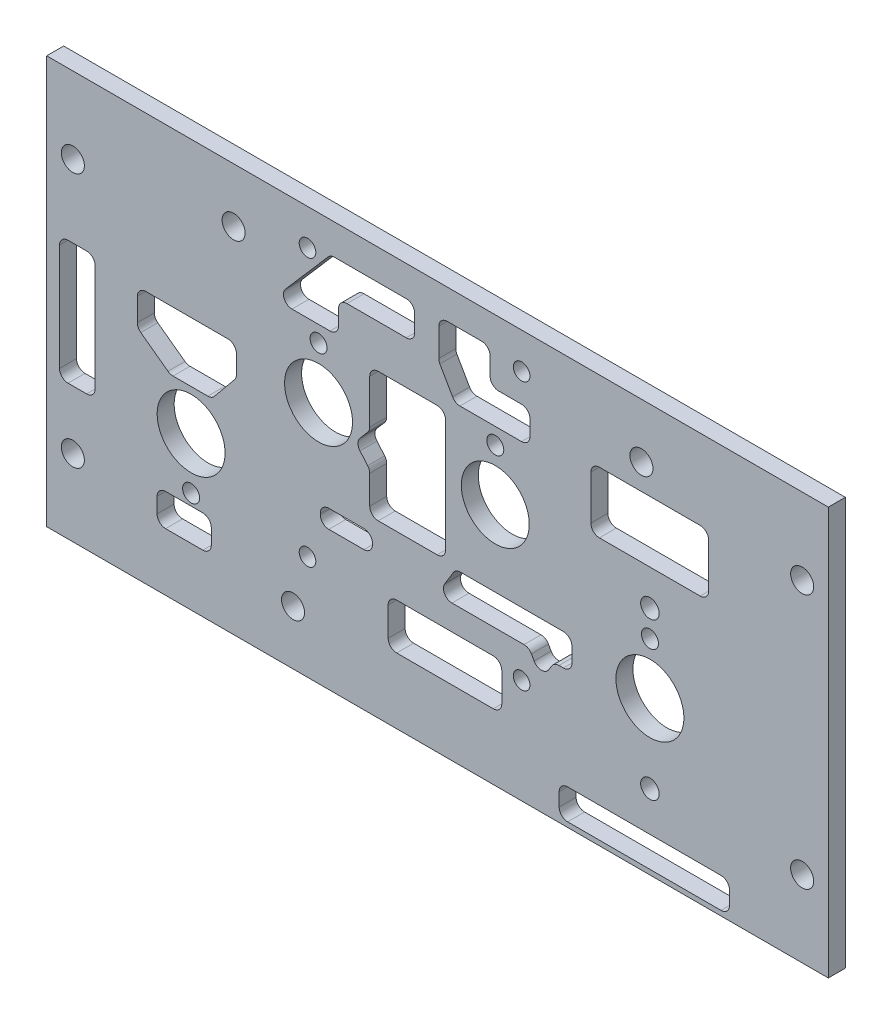
from build123d import *

# Parameters (mm, degrees)
SKETCH1_W                    = 146.05
SKETCH1_H                    = 76.2
BOSS_EXTRUDE1_DEPTH          = 3.175
F_1_8_0_125_DIAMETER_HOLE1_D = 3.175
F_1_2_0_5_DIAMETER_HOLE1_D   = 12.7
F_6_CLEARANCE_HOLE1_D        = 4.3053
F_4_CLEARANCE_HOLE1_D        = 3.4544
SKETCH11_R                   = 1.55
BACKLIGHTING_LED_HOLES_DEPTH = 165.763840466


with BuildPart() as part:
    # Sketch1 → Boss-Extrude1 (new body)
    with BuildSketch(Plane.XY):
        with Locations((-73.025, 38.1)):
            Rectangle(SKETCH1_W, SKETCH1_H)
    extrude(amount=-BOSS_EXTRUDE1_DEPTH)

    # 1/8 (0.125) Diameter Hole1 (through all)
    with Locations(Plane(origin=(0, 0, -3.175), x_dir=(-1, 0, 0), z_dir=(0, 0, -1))):
        with Locations((95.25, 55.118), (119.0625, 18.923), (62.23, 55.118), (33.3375, 38.227)):
            Hole(F_1_8_0_125_DIAMETER_HOLE1_D / 2)

    # 1/2 (0.5) Diameter Hole1 (through all)
    with Locations(Plane(origin=(0, 0, -3.175), x_dir=(-1, 0, 0), z_dir=(0, 0, -1))):
        with Locations((95.25, 45.466), (119.0625, 28.575), (62.23, 45.466), (33.3375, 28.575)):
            Hole(F_1_2_0_5_DIAMETER_HOLE1_D / 2)

    # #6 Clearance Hole1 (through all)
    with Locations(Plane(origin=(0, 0, -3.175), x_dir=(-1, 0, 0), z_dir=(0, 0, -1))):
        with Locations((141.1605, 61.9125), (141.1605, 14.2875), (4.8895, 61.9125), (4.8895, 14.2875), (111.125, 66.04), (100.01504, 10.16), (34.925, 66.04)):
            Hole(F_6_CLEARANCE_HOLE1_D / 2)

    # #4 Clearance Hole1 (through all)
    with Locations(Plane(origin=(0, 0, -3.175), x_dir=(-1, 0, 0), z_dir=(0, 0, -1))):
        with Locations((33.3375, 43.18), (33.3375, 13.97)):
            Hole(F_4_CLEARANCE_HOLE1_D / 2)

    # Sketch11 → Backlighting LED Holes (cut, through all)
    with BuildSketch(Plane(origin=(0, 0, -3.175), x_dir=(-1, 0, 0), z_dir=(0, 0, -1))):
        with Locations((57.308481915, 69.502362759)):
            Circle(SKETCH11_R)
        with Locations((97.316390057, 69.502362759)):
            Circle(SKETCH11_R)
        with Locations((57.308481915, 19.508183769)):
            Circle(SKETCH11_R)
        with Locations((97.316390057, 19.508183769)):
            Circle(SKETCH11_R)
        with BuildLine():
            Line((23.948701738, 61.259955387), (42.783329433, 61.259955387))
            ThreePointArc((42.783329433, 61.259955387), (43.905861448, 60.794987403), (44.370829433, 59.672455387))
            Line((44.370829433, 59.672455387), (44.370829433, 51.419528758))
            ThreePointArc((44.370829433, 51.419528758), (43.905861448, 50.296996743), (42.783329433, 49.832028758))
            Line((42.783329433, 49.832028758), (23.948701738, 49.832028758))
            ThreePointArc((23.948701738, 49.832028758), (22.826169723, 50.296996743), (22.361201738, 51.419528758))
            Line((22.361201738, 51.419528758), (22.361201738, 59.672455387))
            ThreePointArc((22.361201738, 59.672455387), (22.826169723, 60.794987403), (23.948701738, 61.259955387))
        make_face()
        with BuildLine():
            Line((64.780071341, 70.654448124), (71.201339032, 70.654448124))
            ThreePointArc((71.201339032, 70.654448124), (72.323871047, 70.189480139), (72.788839032, 69.066948124))
            Line((72.788839032, 69.066948124), (72.788839032, 63.862845981))
            ThreePointArc((72.788839032, 63.862845981), (72.735316858, 63.454106112), (72.578359309, 63.072927373))
            Line((72.578359309, 63.072927373), (70.206670251, 58.938496447))
            ThreePointArc((70.206670251, 58.938496447), (69.625313364, 58.354706199), (68.829649974, 58.140915055))
            Line((68.829649974, 58.140915055), (57.333367613, 58.140915055))
            ThreePointArc((57.333367613, 58.140915055), (56.210835598, 58.60588304), (55.745867613, 59.728415055))
            Line((55.745867613, 59.728415055), (55.745867613, 62.595888343))
            ThreePointArc((55.745867613, 62.595888343), (56.210835598, 63.718420358), (57.333367613, 64.183388343))
            Line((57.333367613, 64.183388343), (61.605071341, 64.183388343))
            ThreePointArc((61.605071341, 64.183388343), (62.727603357, 64.648356328), (63.192571341, 65.770888343))
            Line((63.192571341, 65.770888343), (63.192571341, 69.066948124))
            ThreePointArc((63.192571341, 69.066948124), (63.657539326, 70.189480139), (64.780071341, 70.654448124))
        make_face()
        with BuildLine():
            Line((78.87082721, 70.489430061), (92.270025031, 70.489430061))
            ThreePointArc((92.270025031, 70.489430061), (92.929418885, 70.346006234), (93.469665918, 69.941650211))
            Line((93.469665918, 69.941650211), (101.420285558, 60.768135206))
            ThreePointArc((101.420285558, 60.768135206), (101.664720844, 59.0690212), (100.22064467, 58.140915055))
            Line((100.22064467, 58.140915055), (93.109864956, 58.140915055))
            ThreePointArc((93.109864956, 58.140915055), (91.987332941, 58.60588304), (91.522364956, 59.728415055))
            Line((91.522364956, 59.728415055), (91.522364956, 62.57909604))
            ThreePointArc((91.522364956, 62.57909604), (91.057396971, 63.701628055), (89.934864956, 64.16659604))
            Line((89.934864956, 64.16659604), (78.87082721, 64.16659604))
            ThreePointArc((78.87082721, 64.16659604), (77.748295195, 64.631564024), (77.28332721, 65.75409604))
            Line((77.28332721, 65.75409604), (77.28332721, 68.901930061))
            ThreePointArc((77.28332721, 68.901930061), (77.748295195, 70.024462076), (78.87082721, 70.489430061))
        make_face()
        with BuildLine():
            Line((73.096623307, 56.116253723), (84.101981767, 56.116253723))
            ThreePointArc((84.101981767, 56.116253723), (85.224513783, 55.651285738), (85.689481767, 54.528753723))
            Line((85.689481767, 54.528753723), (85.689481767, 46.305527038))
            ThreePointArc((85.689481767, 46.305527038), (85.788811506, 45.752801497), (86.074370615, 45.269243936))
            Line((86.074370615, 45.269243936), (87.505032443, 43.608954517))
            ThreePointArc((87.505032443, 43.608954517), (87.889920523, 42.574233054), (87.507068918, 41.538756358))
            Line((87.507068918, 41.538756358), (86.072334141, 39.867100807))
            ThreePointArc((86.072334141, 39.867100807), (85.788268505, 39.384447096), (85.689481767, 38.83318575))
            Line((85.689481767, 38.83318575), (85.689481767, 33.514880522))
            ThreePointArc((85.689481767, 33.514880522), (85.224513783, 32.392348507), (84.101981767, 31.927380522))
            Line((84.101981767, 31.927380522), (73.096623307, 31.927380522))
            ThreePointArc((73.096623307, 31.927380522), (71.974091291, 32.392348507), (71.509123307, 33.514880522))
            Line((71.509123307, 33.514880522), (71.509123307, 54.528753723))
            ThreePointArc((71.509123307, 54.528753723), (71.974091291, 55.651285738), (73.096623307, 56.116253723))
        make_face()
        with BuildLine():
            Line((49.495086903, 31.307548148), (68.728160767, 31.307548148))
            ThreePointArc((68.728160767, 31.307548148), (69.504729221, 31.104641116), (70.082782777, 30.547789326))
            Line((70.082782777, 30.547789326), (71.680994153, 27.932270896))
            ThreePointArc((71.680994153, 27.932270896), (71.71096511, 26.327961263), (70.326372142, 25.517029718))
            Line((70.326372142, 25.517029718), (56.856618733, 25.517029718))
            ThreePointArc((56.856618733, 25.517029718), (56.054963226, 25.299750393), (55.47275108, 24.707389967))
            Line((55.47275108, 24.707389967), (54.96899506, 23.811172863))
            ThreePointArc((54.96899506, 23.811172863), (53.614038541, 23.001796395), (52.230505396, 23.761291934))
            Line((52.230505396, 23.761291934), (51.684339715, 24.655107626))
            ThreePointArc((51.684339715, 24.655107626), (51.106286159, 25.211959415), (50.329717704, 25.414866448))
            Line((50.329717704, 25.414866448), (49.495086903, 25.414866448))
            ThreePointArc((49.495086903, 25.414866448), (48.372554888, 25.879834433), (47.907586903, 27.002366448))
            Line((47.907586903, 27.002366448), (47.907586903, 29.720048148))
            ThreePointArc((47.907586903, 29.720048148), (48.372554888, 30.842580163), (49.495086903, 31.307548148))
        make_face()
        with BuildLine():
            Line((138.589154923, 48.348748794), (142.062048865, 48.348748794))
            ThreePointArc((142.062048865, 48.348748794), (143.18458088, 47.883780809), (143.649548865, 46.761248794))
            Line((143.649548865, 46.761248794), (143.649548865, 26.810643633))
            ThreePointArc((143.649548865, 26.810643633), (143.18458088, 25.688111618), (142.062048865, 25.223143633))
            Line((142.062048865, 25.223143633), (138.589154923, 25.223143633))
            ThreePointArc((138.589154923, 25.223143633), (137.466622908, 25.688111618), (137.001654923, 26.810643633))
            Line((137.001654923, 26.810643633), (137.001654923, 46.761248794))
            ThreePointArc((137.001654923, 46.761248794), (137.466622908, 47.883780809), (138.589154923, 48.348748794))
        make_face()
        with BuildLine():
            Line((112.187953155, 47.328686282), (127.528056033, 47.328686282))
            ThreePointArc((127.528056033, 47.328686282), (128.650588048, 46.863718297), (129.115556033, 45.741186282))
            Line((129.115556033, 45.741186282), (129.115556033, 41.488707605))
            ThreePointArc((129.115556033, 41.488707605), (128.943947253, 40.770788179), (128.466222738, 40.20808296))
            Line((128.466222738, 40.20808296), (123.390276389, 36.489519616))
            ThreePointArc((123.390276389, 36.489519616), (122.945650272, 36.261312284), (122.452109684, 36.182644262))
            Line((122.452109684, 36.182644262), (115.941089528, 36.182644262))
            ThreePointArc((115.941089528, 36.182644262), (115.262424348, 36.335024119), (114.71404566, 36.762910627))
            Line((114.71404566, 36.762910627), (110.960909287, 41.335100049))
            ThreePointArc((110.960909287, 41.335100049), (110.69328122, 41.807439251), (110.600453155, 42.342333684))
            Line((110.600453155, 42.342333684), (110.600453155, 45.741186282))
            ThreePointArc((110.600453155, 45.741186282), (111.06542114, 46.863718297), (112.187953155, 47.328686282))
        make_face()
        with BuildLine():
            Line((20.051024651, 6.571971652), (48.712319434, 6.571971652))
            ThreePointArc((48.712319434, 6.571971652), (49.834851449, 6.107003667), (50.299819434, 4.984471652))
            Line((50.299819434, 4.984471652), (50.299819434, 2.503851427))
            ThreePointArc((50.299819434, 2.503851427), (49.834851449, 1.381319412), (48.712319434, 0.916351427))
            Line((48.712319434, 0.916351427), (20.051024651, 0.916351427))
            ThreePointArc((20.051024651, 0.916351427), (18.928492635, 1.381319412), (18.463524651, 2.503851427))
            Line((18.463524651, 2.503851427), (18.463524651, 4.984471652))
            ThreePointArc((18.463524651, 4.984471652), (18.928492635, 6.107003667), (20.051024651, 6.571971652))
        make_face()
        with BuildLine():
            Line((116.881679104, 16.821615791), (123.831598801, 16.821615791))
            ThreePointArc((123.831598801, 16.821615791), (124.954130816, 16.356647806), (125.419098801, 15.234115791))
            Line((125.419098801, 15.234115791), (125.419098801, 12.383018457))
            ThreePointArc((125.419098801, 12.383018457), (124.954130816, 11.260486442), (123.831598801, 10.795518457))
            Line((123.831598801, 10.795518457), (116.881679104, 10.795518457))
            ThreePointArc((116.881679104, 10.795518457), (115.759147089, 11.260486442), (115.294179104, 12.383018457))
            Line((115.294179104, 12.383018457), (115.294179104, 15.234115791))
            ThreePointArc((115.294179104, 15.234115791), (115.759147089, 16.356647806), (116.881679104, 16.821615791))
        make_face()
        with BuildLine():
            Line((86.76531931, 29.342846343), (93.337345817, 29.342846343))
            ThreePointArc((93.337345817, 29.342846343), (94.459877833, 28.877878358), (94.924845817, 27.755346343))
            Line((94.924845817, 27.755346343), (94.924845817, 27.524144469))
            ThreePointArc((94.924845817, 27.524144469), (94.459877833, 26.401612454), (93.337345817, 25.936644469))
            Line((93.337345817, 25.936644469), (86.76531931, 25.936644469))
            ThreePointArc((86.76531931, 25.936644469), (85.642787295, 26.401612454), (85.17781931, 27.524144469))
            Line((85.17781931, 27.524144469), (85.17781931, 27.755346343))
            ThreePointArc((85.17781931, 27.755346343), (85.642787295, 28.877878358), (86.76531931, 29.342846343))
        make_face()
        with BuildLine():
            Line((62.601923732, 20.822765056), (80.659320952, 20.822765056))
            ThreePointArc((80.659320952, 20.822765056), (81.781852968, 20.357797071), (82.246820952, 19.235265056))
            Line((82.246820952, 19.235265056), (82.246820952, 13.853449801))
            ThreePointArc((82.246820952, 13.853449801), (81.781852968, 12.730917786), (80.659320952, 12.265949801))
            Line((80.659320952, 12.265949801), (62.601923732, 12.265949801))
            ThreePointArc((62.601923732, 12.265949801), (61.479391717, 12.730917786), (61.014423732, 13.853449801))
            Line((61.014423732, 13.853449801), (61.014423732, 19.235265056))
            ThreePointArc((61.014423732, 19.235265056), (61.479391717, 20.357797071), (62.601923732, 20.822765056))
        make_face()
    extrude(amount=-BACKLIGHTING_LED_HOLES_DEPTH, mode=Mode.SUBTRACT)


solid = part.part
